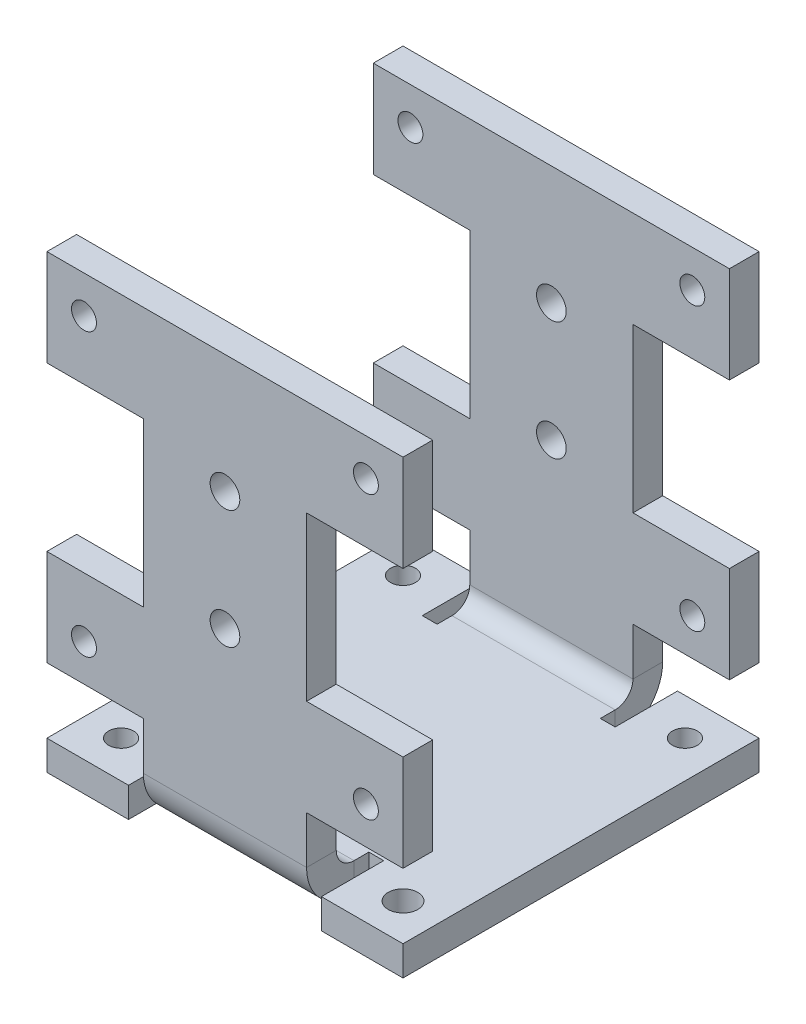
from build123d import *

# Parameters (mm, degrees)
SKETCH_16_R                       = 2.1
SKETCH_16_R_2                     = 2.5
SM_BASE_FLANGE_2_DEPTH            = 5
SM_EDGE_FLANGE_1_STRIP_W          = 26
SM_EDGE_FLANGE_1_STRIP_H          = 5
SM_EDGE_FLANGE_1_STRIP_CUT_DEPTH  = 27.5
SM_EDGE_FLANGE_1_RELIEF_W         = 28.5
SM_EDGE_FLANGE_1_RELIEF_H         = 2.5
SM_EDGE_FLANGE_1_RELIEF_CUT_DEPTH = 5
SM_EDGE_FLANGE_1_DEPTH            = 27.5
SM_EDGE_FLANGE_2_STRIP_W          = 26
SM_EDGE_FLANGE_2_STRIP_H          = 5
SM_EDGE_FLANGE_2_STRIP_CUT_DEPTH  = 27.5
SM_EDGE_FLANGE_2_RELIEF_W         = 28.5
SM_EDGE_FLANGE_2_RELIEF_H         = 2.5
SM_EDGE_FLANGE_2_RELIEF_CUT_DEPTH = 5
SM_EDGE_FLANGE_2_DEPTH            = 27.5
EXTRUDE_START                     = 30
SKETCH_23_W                       = 16.25
SKETCH_23_H                       = 16.25
EXTRUDE_1_DEPTH                   = 5
EXTRUDE_START_2                   = -25
SKETCH_24_W                       = 16.25
SKETCH_24_H                       = 16.25
EXTRUDE_2_DEPTH                   = 5
CUT_EXTRUDE_1_DEPTH               = 83.710337927
CUT_EXTRUDE_1_DEPTH_BACK          = 83.710337927
SKETCH_25_R                       = 2.1
CUT_EXTRUDE_2_DEPTH               = 83.710337927
CUT_EXTRUDE_2_DEPTH_BACK          = 83.710337927
SKETCH_26_R                       = 2.5


# Sheet-metal steps are written as plain solids
with BuildPart() as part:
    # 草图16 → 基体-法兰2 (new body)
    with BuildSketch(Plane(origin=(0, 0, 0), x_dir=(1, 0, 0), z_dir=(0, 1, 0))):
        Polygon((16.25, 30), (30, 30), (30, -30), (16.25, -30), (16.25, -25), (-16.25, -25), (-16.25, -30), (-30, -30), (-30, 30), (-16.25, 30), (-16.25, 25), (16.25, 25), align=None)
        with Locations(Location((-23.75, 23.75, 0), (0, 0, 270))):
            Circle(SKETCH_16_R, mode=Mode.SUBTRACT)
        with Locations(Location((-23.75, -23.75, 0), (0, 0, 270))):
            Circle(SKETCH_16_R, mode=Mode.SUBTRACT)
        with Locations(Location((23.75, 23.75, 0), (0, 0, 270))):
            Circle(SKETCH_16_R, mode=Mode.SUBTRACT)
        with Locations(Location((23.75, -23.75, 0), (0, 0, 270))):
            Circle(SKETCH_16_R_2, mode=Mode.SUBTRACT)
    extrude(amount=-SM_BASE_FLANGE_2_DEPTH)

    # 边线-法兰1 strip (across the edge) → 边线-法兰1 strip cut (cut)
    with BuildSketch(Plane(origin=(-13.75, 0, 25), x_dir=(0, 0, -1), z_dir=(1, 0, 0))):
        with Locations((-10, -2.5)):
            Rectangle(SM_EDGE_FLANGE_1_STRIP_W, SM_EDGE_FLANGE_1_STRIP_H)
    extrude(amount=SM_EDGE_FLANGE_1_STRIP_CUT_DEPTH, mode=Mode.SUBTRACT)

    # 边线-法兰1 relief (on the sheet) → 边线-法兰1 relief cut (cut)
    with BuildSketch(Plane(origin=(-13.75, 0, 22), x_dir=(0, 0, -1), z_dir=(0, 1, 0))):
        with Locations((-11.75, 1.25)):
            Rectangle(SM_EDGE_FLANGE_1_RELIEF_W, SM_EDGE_FLANGE_1_RELIEF_H)
        with Locations((-11.75, -28.75)):
            Rectangle(SM_EDGE_FLANGE_1_RELIEF_W, SM_EDGE_FLANGE_1_RELIEF_H)
    extrude(amount=-SM_EDGE_FLANGE_1_RELIEF_CUT_DEPTH, mode=Mode.SUBTRACT)

    # 边线-法兰1 section (across the edge) → 边线-法兰1 (add)
    with BuildSketch(Plane(origin=(-13.75, 0, 25), x_dir=(0, 0, -1), z_dir=(1, 0, 0))):
        with BuildLine():
            Line((-5, 3), (-5, 71))
            Line((-5, 71), (0, 71))
            Line((0, 71), (0, 3))
            ThreePointArc((0, 3), (0.878679656, 0.878679656), (3, 0))
            Line((3, 0), (3, -5))
            ThreePointArc((3, -5), (-2.656854249, -2.656854249), (-5, 3))
        make_face()
    extrude(amount=SM_EDGE_FLANGE_1_DEPTH)

    # 边线-法兰2 strip (across the edge) → 边线-法兰2 strip cut (cut)
    with BuildSketch(Plane(origin=(13.75, 0, -25), x_dir=(0, 0, 1), z_dir=(-1, 0, 0))):
        with Locations((-10, -2.5)):
            Rectangle(SM_EDGE_FLANGE_2_STRIP_W, SM_EDGE_FLANGE_2_STRIP_H)
    extrude(amount=SM_EDGE_FLANGE_2_STRIP_CUT_DEPTH, mode=Mode.SUBTRACT)

    # 边线-法兰2 relief (on the sheet) → 边线-法兰2 relief cut (cut)
    with BuildSketch(Plane(origin=(13.75, 0, -22), x_dir=(0, 0, 1), z_dir=(0, 1, 0))):
        with Locations((-11.75, 1.25)):
            Rectangle(SM_EDGE_FLANGE_2_RELIEF_W, SM_EDGE_FLANGE_2_RELIEF_H)
        with Locations((-11.75, -28.75)):
            Rectangle(SM_EDGE_FLANGE_2_RELIEF_W, SM_EDGE_FLANGE_2_RELIEF_H)
    extrude(amount=-SM_EDGE_FLANGE_2_RELIEF_CUT_DEPTH, mode=Mode.SUBTRACT)

    # 边线-法兰2 section (across the edge) → 边线-法兰2 (add)
    with BuildSketch(Plane(origin=(13.75, 0, -25), x_dir=(0, 0, 1), z_dir=(-1, 0, 0))):
        with BuildLine():
            Line((-5, 3), (-5, 71))
            Line((-5, 71), (0, 71))
            Line((0, 71), (0, 3))
            ThreePointArc((0, 3), (0.878679656, 0.878679656), (3, 0))
            Line((3, 0), (3, -5))
            ThreePointArc((3, -5), (-2.656854249, -2.656854249), (-5, 3))
        make_face()
    extrude(amount=SM_EDGE_FLANGE_2_DEPTH)

    # 草图23 → 凸台-拉伸1 (add)
    with BuildSketch(Plane.XY.offset(EXTRUDE_START)):
        with Locations((-21.875, 62.875)):
            Rectangle(SKETCH_23_W, SKETCH_23_H)
        with Locations((21.875, 62.875)):
            Rectangle(SKETCH_23_W, SKETCH_23_H)
        with Locations((21.875, 19.125)):
            Rectangle(SKETCH_23_W, SKETCH_23_H)
        with Locations((-21.875, 19.125)):
            Rectangle(SKETCH_23_W, SKETCH_23_H)
    extrude(amount=-EXTRUDE_1_DEPTH)

    # 草图24 → 凸台-拉伸2 (add)
    with BuildSketch(Plane.XY.offset(EXTRUDE_START_2)):
        with Locations((21.875, 62.875)):
            Rectangle(SKETCH_24_W, SKETCH_24_H)
        with Locations((-21.875, 62.875)):
            Rectangle(SKETCH_24_W, SKETCH_24_H)
        with Locations((-21.875, 19.125)):
            Rectangle(SKETCH_24_W, SKETCH_24_H)
        with Locations((21.875, 19.125)):
            Rectangle(SKETCH_24_W, SKETCH_24_H)
    extrude(amount=-EXTRUDE_2_DEPTH)

    # 草图25 → 切除-拉伸1 (cut, two sides: drawn at the far end of the back side and taken through both)
    with BuildSketch(Plane.XY.offset(-CUT_EXTRUDE_1_DEPTH_BACK)):
        with Locations((-23.75, 64.75)):
            Circle(SKETCH_25_R)
        with Locations((23.75, 64.75)):
            Circle(SKETCH_25_R)
        with Locations((-23.75, 17.25)):
            Circle(SKETCH_25_R)
        with Locations((23.75, 17.25)):
            Circle(SKETCH_25_R)
    extrude(amount=CUT_EXTRUDE_1_DEPTH + CUT_EXTRUDE_1_DEPTH_BACK, mode=Mode.SUBTRACT)

    # 草图26 → 切除-拉伸2 (cut, two sides: drawn at the far end of the back side and taken through both)
    with BuildSketch(Plane.XY.offset(-CUT_EXTRUDE_2_DEPTH_BACK)):
        with Locations((0, 51)):
            Circle(SKETCH_26_R)
        with Locations((0, 31)):
            Circle(SKETCH_26_R)
    extrude(amount=CUT_EXTRUDE_2_DEPTH + CUT_EXTRUDE_2_DEPTH_BACK, mode=Mode.SUBTRACT)


solid = part.part
